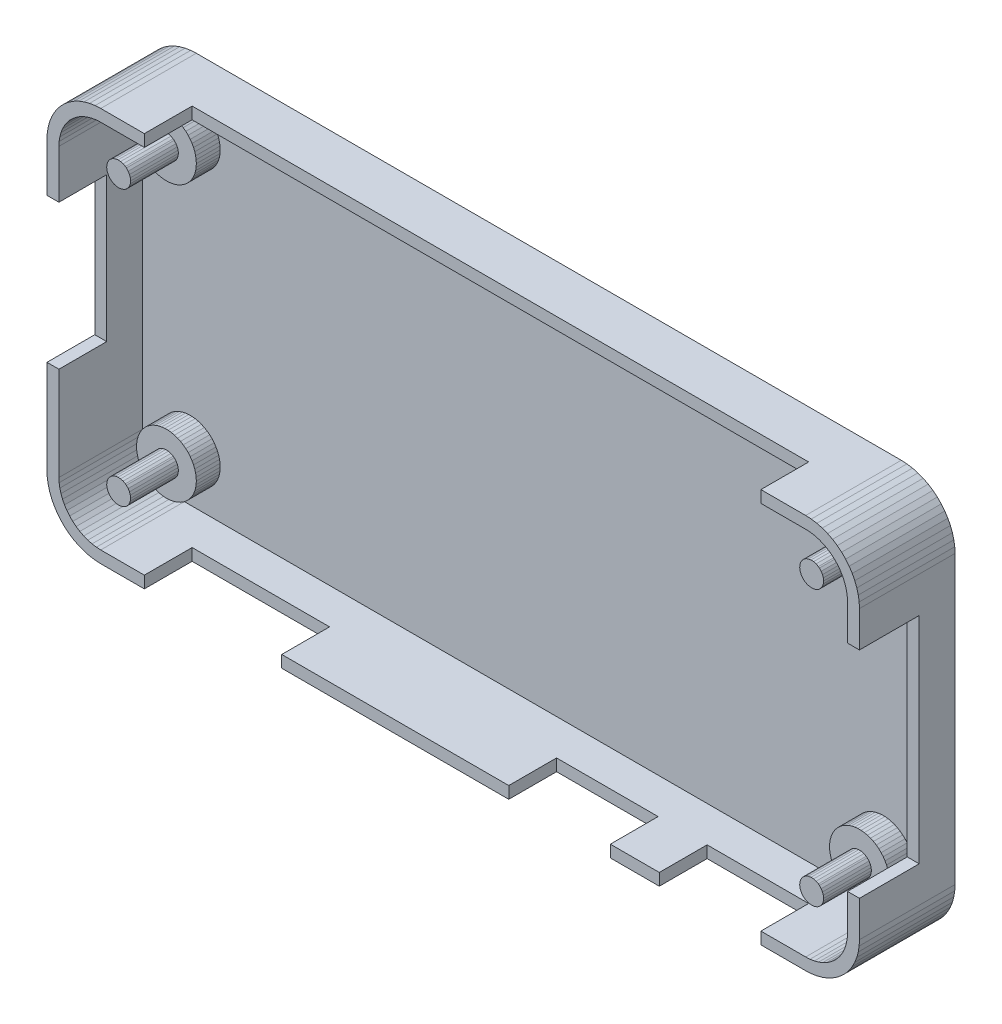
from build123d import *
from OCP.BRepFilletAPI import BRepFilletAPI_MakeChamfer

# Parameters (mm, degrees)
BOSS_EXTRUDE1_DEPTH = 8.00000038
CUT_EXTRUDE1_DEPTH  = 7.000000332
CUT_EXTRUDE2_REACH  = 50.052
SKETCH3_W           = 11.500000022
SKETCH3_H           = 4.00000019
CUT_EXTRUDE3_REACH  = 50.052
SKETCH4_W           = 8.499999996
SKETCH4_H           = 4.00000019
CUT_EXTRUDE4_REACH  = 50.052
SKETCH5_W           = 8.500000462
SKETCH5_H           = 4.00000019
CUT_EXTRUDE5_REACH  = 72.429
SKETCH6_W           = 4.00000019
SKETCH6_H           = 12.1000004
CUT_EXTRUDE6_REACH  = 72.429
SKETCH7_W           = 5.000000354
SKETCH7_H           = 17.999999226
BOSS_EXTRUDE2_DEPTH = 1.999999979
BOSS_EXTRUDE3_DEPTH = 4.00000019
BOSS_EXTRUDE4_DEPTH = 1.999999979
BOSS_EXTRUDE5_DEPTH = 4.00000019
BOSS_EXTRUDE6_DEPTH = 1.999999979
BOSS_EXTRUDE7_DEPTH = 4.00000019
BOSS_EXTRUDE8_DEPTH = 1.999999979
BOSS_EXTRUDE9_DEPTH = 4.00000019
CHAMFER1_SIZE       = 0.054860139
CHAMFER1_SIZE2      = 0.054863094
CHAMFER2_SIZE       = 0.054859988
CHAMFER2_SIZE2      = 0.054863254
CHAMFER3_SIZE       = 0.054856963
CHAMFER3_SIZE2      = 0.05486496
CHAMFER4_SIZE       = 0.054861855
CHAMFER4_SIZE2      = 0.054861534
CHAMFER5_SIZE       = 0.054854337
CHAMFER5_SIZE2      = 0.054868191
CHAMFER6_SIZE       = 0.054859229
CHAMFER6_SIZE2      = 0.054864765
SKETCH16_W          = 51.59999989
SKETCH16_H          = 4.00000019
CUT_EXTRUDE7_DEPTH  = 10


with BuildPart() as part:
    # Sketch1 → Boss-Extrude1 (new body)
    with BuildSketch(Plane(origin=(0, 0, 0), x_dir=(-1, 0, 0), z_dir=(0, 0, -1))):
        Polygon((29.500000179, 16.499999911), (-29.500000179, 16.499999911), (-29.970377684, 16.475347802), (-30.435603112, 16.401663423), (-30.890576541, 16.27975516), (-31.330313534, 16.110954806), (-31.750001013, 15.89711383), (-32.145034522, 15.640577301), (-32.511088997, 15.344151296), (-32.844152302, 15.011087991), (-33.140577376, 14.645033516), (-33.397115767, 14.250000007), (-33.610954881, 13.830315322), (-33.779755235, 13.390576467), (-33.90166536, 12.935603037), (-33.975347877, 12.47037854), (-34.000001848, 12.000000104), (-34.000001848, -12.000000104), (-33.975347877, -12.47037854), (-33.90166536, -12.935603037), (-33.779755235, -13.390576467), (-33.610954881, -13.830315322), (-33.397115767, -14.250000007), (-33.140577376, -14.645033516), (-32.844152302, -15.011087991), (-32.511088997, -15.344151296), (-32.145034522, -15.640577301), (-31.750001013, -15.89711383), (-31.330313534, -16.110954806), (-30.890576541, -16.27975516), (-30.435603112, -16.401663423), (-29.970377684, -16.475347802), (-29.500000179, -16.499999911), (29.500000179, -16.499999911), (29.970377684, -16.475347802), (30.435603112, -16.401663423), (30.890576541, -16.27975516), (31.330313534, -16.110954806), (31.750001013, -15.89711383), (32.145034522, -15.640577301), (32.511088997, -15.344151296), (32.844152302, -15.011087991), (33.140577376, -14.645033516), (33.397115767, -14.250000007), (33.610954881, -13.830315322), (33.779755235, -13.390576467), (33.90166536, -12.935603037), (33.975347877, -12.47037854), (34.000001848, -12.000000104), (34.000001848, 12.000000104), (33.975347877, 12.47037854), (33.90166536, 12.935603037), (33.779755235, 13.390576467), (33.610954881, 13.830315322), (33.397115767, 14.250000007), (33.140577376, 14.645033516), (32.844152302, 15.011087991), (32.511088997, 15.344151296), (32.145034522, 15.640577301), (31.750001013, 15.89711383), (31.330313534, 16.110954806), (30.890576541, 16.27975516), (30.435603112, 16.401663423), (29.970377684, 16.475347802), align=None)
    extrude(amount=-BOSS_EXTRUDE1_DEPTH)

    # Sketch2 → Cut-Extrude1 (cut)
    with BuildSketch(Plane.XY.offset(8.00000038)):
        Polygon((-30.581559986, -15.32869786), (-30.227690935, -15.423515812), (-29.865849763, -15.480826609), (-29.500000179, -15.499999747), (29.500000179, -15.499999747), (29.865849763, -15.480826609), (30.227690935, -15.423515812), (30.581559986, -15.32869786), (30.923578888, -15.197409317), (31.25, -15.031089075), (31.557247043, -14.831559733), (31.841956079, -14.601007104), (32.101005316, -14.341956936), (32.331559807, -14.057248831), (32.531090081, -13.749999925), (32.697409391, -13.423577882), (32.828696072, -13.081559911), (32.923515886, -12.727690861), (32.980825752, -12.365849689), (32.999999821, -12.000000104), (32.999999821, 12.000000104), (32.980825752, 12.365849689), (32.923515886, 12.727690861), (32.828696072, 13.081559911), (32.697409391, 13.423577882), (32.531090081, 13.749999925), (32.331559807, 14.057248831), (32.101005316, 14.341956936), (31.841956079, 14.601007104), (31.557247043, 14.831559733), (31.25, 15.031089075), (30.923578888, 15.197409317), (30.581559986, 15.32869786), (30.227690935, 15.423515812), (29.865849763, 15.480826609), (29.500000179, 15.499999747), (-29.500000179, 15.499999747), (-29.865849763, 15.480826609), (-30.227690935, 15.423515812), (-30.581559986, 15.32869786), (-30.923578888, 15.197409317), (-31.25, 15.031089075), (-31.557247043, 14.831559733), (-31.841956079, 14.601007104), (-32.101005316, 14.341956936), (-32.331559807, 14.057248831), (-32.531090081, 13.749999925), (-32.697409391, 13.423577882), (-32.828696072, 13.081559911), (-32.923515886, 12.727690861), (-32.980825752, 12.365849689), (-32.999999821, 12.000000104), (-32.999999821, -12.000000104), (-32.980825752, -12.365849689), (-32.923515886, -12.727690861), (-32.828696072, -13.081559911), (-32.697409391, -13.423577882), (-32.531090081, -13.749999925), (-32.331559807, -14.057248831), (-32.101005316, -14.341956936), (-31.841956079, -14.601007104), (-31.557247043, -14.831559733), (-31.25, -15.031089075), (-30.923578888, -15.197409317), align=None)
    extrude(amount=-CUT_EXTRUDE1_DEPTH, mode=Mode.SUBTRACT)

    # Sketch3 → Cut-Extrude2 (cut, up to next)
    with BuildSketch(Plane.XZ.offset(16.499999911), mode=Mode.PRIVATE) as cut_extrude2_sk1:
        with Locations((-20.099999849, 6.000000285)):
            Rectangle(SKETCH3_W, SKETCH3_H)
    cut_extrude2_tool1 = extrude(cut_extrude2_sk1.sketch, amount=-CUT_EXTRUDE2_REACH, mode=Mode.PRIVATE) & part.part
    add(cut_extrude2_tool1.solids().sort_by_distance((-20.1, -16.5, 6))[0], mode=Mode.SUBTRACT)

    # Sketch4 → Cut-Extrude3 (cut, up to next)
    with BuildSketch(Plane.XZ.offset(16.499999911), mode=Mode.PRIVATE) as cut_extrude3_sk1:
        with Locations((8.900000015, 6.000000285)):
            Rectangle(SKETCH4_W, SKETCH4_H)
    cut_extrude3_tool1 = extrude(cut_extrude3_sk1.sketch, amount=-CUT_EXTRUDE3_REACH, mode=Mode.PRIVATE) & part.part
    add(cut_extrude3_tool1.solids().sort_by_distance((8.9, -16.5, 6))[0], mode=Mode.SUBTRACT)

    # Sketch5 → Cut-Extrude4 (cut, up to next)
    with BuildSketch(Plane.XZ.offset(16.499999911), mode=Mode.PRIVATE) as cut_extrude4_sk1:
        with Locations((21.499999799, 6.000000285)):
            Rectangle(SKETCH5_W, SKETCH5_H)
    cut_extrude4_tool1 = extrude(cut_extrude4_sk1.sketch, amount=-CUT_EXTRUDE4_REACH, mode=Mode.PRIVATE) & part.part
    add(cut_extrude4_tool1.solids().sort_by_distance((21.5, -16.5, 6))[0], mode=Mode.SUBTRACT)

    # Sketch6 → Cut-Extrude5 (cut, up to next)
    with BuildSketch(Plane.ZY.offset(34.000001848), mode=Mode.PRIVATE) as cut_extrude5_sk1:
        with Locations((6.000000285, 1.900000265)):
            Rectangle(SKETCH6_W, SKETCH6_H)
    cut_extrude5_tool1 = extrude(cut_extrude5_sk1.sketch, amount=-CUT_EXTRUDE5_REACH, mode=Mode.PRIVATE) & part.part
    add(cut_extrude5_tool1.solids().sort_by_distance((-34.000002, 1.9, 6))[0], mode=Mode.SUBTRACT)

    # Sketch7 → Cut-Extrude6 (cut, up to next)
    with BuildSketch(Plane(origin=(34.000001848, 0, 0), x_dir=(0, 0, -1), z_dir=(1, 0, 0)), mode=Mode.PRIVATE) as cut_extrude6_sk1:
        with Locations((-5.500000203, 0)):
            Rectangle(SKETCH7_W, SKETCH7_H)
    cut_extrude6_tool1 = extrude(cut_extrude6_sk1.sketch, amount=-CUT_EXTRUDE6_REACH, mode=Mode.PRIVATE) & part.part
    add(cut_extrude6_tool1.solids().sort_by_distance((34.000002, 0, 5.5))[0], mode=Mode.SUBTRACT)

    # Sketch8 → Boss-Extrude2 (add)
    with BuildSketch(Plane.XY.offset(1.000000047)):
        Polygon((-29.404455796, -9.032933973), (-29.13534455, -9.00366623), (-28.864651918, -9.00366623), (-28.595544398, -9.032933973), (-28.331179172, -9.09112487), (-28.074653819, -9.177558124), (-27.828978375, -9.291219525), (-27.597032487, -9.430777282), (-27.381533757, -9.59459506), (-27.185011655, -9.780751541), (-27.009766549, -9.987064637), (-26.857856661, -10.211115703), (-26.731060818, -10.450277478), (-26.630867273, -10.701745749), (-26.558449492, -10.962573811), (-26.514654979, -11.229702272), (-26.499999687, -11.500000022), (-26.514654979, -11.770297773), (-26.558449492, -12.037426233), (-26.630867273, -12.298253365), (-26.731060818, -12.549722567), (-26.857856661, -12.788884342), (-27.009766549, -13.012935407), (-27.185011655, -13.219248503), (-27.381533757, -13.405404985), (-27.597032487, -13.569222763), (-27.828978375, -13.70878052), (-28.074653819, -13.822441921), (-28.331179172, -13.908875175), (-28.595544398, -13.967066072), (-28.864651918, -13.996333815), (-29.13534455, -13.996333815), (-29.404455796, -13.967066072), (-29.668821022, -13.908875175), (-29.925344512, -13.822441921), (-30.171021819, -13.70878052), (-30.402967706, -13.569222763), (-30.618466437, -13.405404985), (-30.814988539, -13.219248503), (-30.990231782, -13.012935407), (-31.142143533, -12.788884342), (-31.268939376, -12.549722567), (-31.369134784, -12.298253365), (-31.441550702, -12.037426233), (-31.485345215, -11.770297773), (-31.500000507, -11.500000022), (-31.485345215, -11.229702272), (-31.441550702, -10.962573811), (-31.369134784, -10.701745749), (-31.268939376, -10.450277478), (-31.142143533, -10.211115703), (-30.990231782, -9.987064637), (-30.814988539, -9.780751541), (-30.618466437, -9.59459506), (-30.402967706, -9.430777282), (-30.171021819, -9.291219525), (-29.925344512, -9.177558124), (-29.668821022, -9.09112487), align=None)
    extrude(amount=BOSS_EXTRUDE2_DEPTH)

    # Sketch9 → Boss-Extrude3 (add)
    with BuildSketch(Plane.XY.offset(3.000000026)):
        Polygon((-29.907574877, -11.080110446), (-29.796093702, -10.894825682), (-29.647385702, -10.737838224), (-29.468407854, -10.616487823), (-29.267529026, -10.536449961), (-29.054138809, -10.501466691), (-28.838217258, -10.513173416), (-28.629861772, -10.571023449), (-28.390347529, -10.698004365), (-28.203906491, -10.894825682), (-28.092425317, -11.080110446), (-28.023378924, -11.285029352), (-28.000000864, -11.500000022), (-28.023378924, -11.714970693), (-28.092425317, -11.919888668), (-28.203906491, -12.105174363), (-28.352614492, -12.262161821), (-28.438812122, -12.327688746), (-28.531592339, -12.383512221), (-28.732471168, -12.463549152), (-28.945861384, -12.498533353), (-29.161781073, -12.486826628), (-29.370138422, -12.428976595), (-29.561186209, -12.327688746), (-29.725994915, -12.187698856), (-29.856856912, -12.015554123), (-29.947653413, -11.819301173), (-30.005930737, -11.554541704), (-29.97662127, -11.285029352), align=None)
    extrude(amount=BOSS_EXTRUDE3_DEPTH)

    # Sketch10 → Boss-Extrude4 (add)
    with BuildSketch(Plane.XY.offset(1.000000047)):
        Polygon((-26.731060818, 10.450277478), (-26.857856661, 10.211115703), (-27.009766549, 9.987064637), (-27.185011655, 9.780751541), (-27.381533757, 9.59459506), (-27.597032487, 9.430777282), (-27.828978375, 9.291219525), (-28.074653819, 9.177558124), (-28.331179172, 9.09112487), (-28.595544398, 9.032933973), (-28.864651918, 9.00366623), (-29.13534455, 9.00366623), (-29.404455796, 9.032933973), (-29.668821022, 9.09112487), (-29.925344512, 9.177558124), (-30.171021819, 9.291219525), (-30.402967706, 9.430777282), (-30.618466437, 9.59459506), (-30.814988539, 9.780751541), (-30.990231782, 9.987064637), (-31.142143533, 10.211115703), (-31.268939376, 10.450277478), (-31.369134784, 10.701745749), (-31.441550702, 10.962573811), (-31.485345215, 11.229702272), (-31.500000507, 11.500000022), (-31.485345215, 11.770297773), (-31.441550702, 12.037426233), (-31.369134784, 12.298253365), (-31.268939376, 12.549722567), (-31.142143533, 12.788884342), (-30.990231782, 13.012935407), (-30.814988539, 13.219248503), (-30.618466437, 13.405404985), (-30.402967706, 13.569222763), (-30.171021819, 13.70878052), (-29.925344512, 13.822441921), (-29.668821022, 13.908875175), (-29.404455796, 13.967066072), (-29.13534455, 13.996333815), (-28.864651918, 13.996333815), (-28.595544398, 13.967066072), (-28.331179172, 13.908875175), (-28.074653819, 13.822441921), (-27.828978375, 13.70878052), (-27.597032487, 13.569222763), (-27.381533757, 13.405404985), (-27.185011655, 13.219248503), (-27.009766549, 13.012935407), (-26.857856661, 12.788884342), (-26.731060818, 12.549722567), (-26.630867273, 12.298253365), (-26.558449492, 12.037426233), (-26.514654979, 11.770297773), (-26.499999687, 11.500000022), (-26.514654979, 11.229702272), (-26.558449492, 10.962573811), (-26.630867273, 10.701745749), align=None)
    extrude(amount=BOSS_EXTRUDE4_DEPTH)

    # Sketch11 → Boss-Extrude5 (add)
    with BuildSketch(Plane.XY.offset(3.000000026)):
        Polygon((-29.907574877, 11.919888668), (-29.796093702, 12.105174363), (-29.647385702, 12.262161821), (-29.468407854, 12.383512221), (-29.267529026, 12.463549152), (-29.054138809, 12.498533353), (-28.838217258, 12.486826628), (-28.629861772, 12.428976595), (-28.390345307, 12.301993334), (-28.203906491, 12.105174363), (-28.092425317, 11.919888668), (-28.023378924, 11.714970693), (-28.000000864, 11.500000022), (-28.023378924, 11.285029352), (-28.092425317, 11.080110446), (-28.203906491, 10.894825682), (-28.352614492, 10.737838224), (-28.438812122, 10.672310367), (-28.531592339, 10.616487823), (-28.732471168, 10.536449961), (-28.945861384, 10.501466691), (-29.161781073, 10.513173416), (-29.370138422, 10.571023449), (-29.561186209, 10.672310367), (-29.725994915, 10.812300257), (-29.856856912, 10.984445922), (-29.947653413, 11.18069794), (-30.00593072, 11.445458499), (-29.97662127, 11.714970693), align=None)
    extrude(amount=BOSS_EXTRUDE5_DEPTH)

    # Sketch12 → Boss-Extrude6 (add)
    with BuildSketch(Plane.XY.offset(1.000000047)):
        Polygon((30.814988539, -9.780751541), (30.990231782, -9.987064637), (31.142143533, -10.211115703), (31.268939376, -10.450277478), (31.369134784, -10.701745749), (31.441550702, -10.962573811), (31.485345215, -11.229702272), (31.500000507, -11.500000022), (31.485345215, -11.770297773), (31.441550702, -12.037426233), (31.369134784, -12.298253365), (31.268939376, -12.549722567), (31.142143533, -12.788884342), (30.990231782, -13.012935407), (30.814988539, -13.219248503), (30.618466437, -13.405404985), (30.402967706, -13.569222763), (30.171021819, -13.70878052), (29.925344512, -13.822441921), (29.668821022, -13.908875175), (29.404455796, -13.967066072), (29.13534455, -13.996333815), (28.864651918, -13.996333815), (28.595544398, -13.967066072), (28.331179172, -13.908875175), (28.074653819, -13.822441921), (27.828978375, -13.70878052), (27.597032487, -13.569222763), (27.381533757, -13.405404985), (27.185011655, -13.219248503), (27.009766549, -13.012935407), (26.857856661, -12.788884342), (26.731060818, -12.549722567), (26.630867273, -12.298253365), (26.558449492, -12.037426233), (26.514654979, -11.770297773), (26.499999687, -11.500000022), (26.514654979, -11.229702272), (26.558449492, -10.962573811), (26.630867273, -10.701745749), (26.731060818, -10.450277478), (26.857856661, -10.211115703), (27.009766549, -9.987064637), (27.185011655, -9.780751541), (27.381533757, -9.59459506), (27.597032487, -9.430777282), (27.828978375, -9.291219525), (28.074653819, -9.177558124), (28.331179172, -9.09112487), (28.595544398, -9.032933973), (28.864651918, -9.00366623), (29.13534455, -9.00366623), (29.404455796, -9.032933973), (29.668821022, -9.09112487), (29.925344512, -9.177558124), (30.171021819, -9.291219525), (30.402967706, -9.430777282), (30.618466437, -9.59459506), align=None)
    extrude(amount=BOSS_EXTRUDE6_DEPTH)

    # Sketch13 → Boss-Extrude7 (add)
    with BuildSketch(Plane.XY.offset(3.000000026)):
        Polygon((28.092425317, -11.080110446), (28.203906491, -10.894825682), (28.352614492, -10.737838224), (28.531592339, -10.616487823), (28.732471168, -10.536449961), (28.945861384, -10.501466691), (29.161781073, -10.513173416), (29.370138422, -10.571023449), (29.609655021, -10.698006852), (29.796093702, -10.894825682), (29.907574877, -11.080110446), (29.97662127, -11.285029352), (29.999999329, -11.500000022), (29.97662127, -11.714970693), (29.907574877, -11.919888668), (29.796093702, -12.105174363), (29.647385702, -12.262161821), (29.561186209, -12.327688746), (29.468407854, -12.383512221), (29.267529026, -12.463549152), (29.054138809, -12.498533353), (28.838217258, -12.486826628), (28.629861772, -12.428976595), (28.438812122, -12.327688746), (28.274005279, -12.187698856), (28.143143281, -12.015554123), (28.052346781, -11.819301173), (27.994069457, -11.554541704), (28.023378924, -11.285029352), align=None)
    extrude(amount=BOSS_EXTRUDE7_DEPTH)

    # Sketch14 → Boss-Extrude8 (add)
    with BuildSketch(Plane.XY.offset(1.000000047)):
        Polygon((31.369134784, 10.701745749), (31.268939376, 10.450277478), (31.142143533, 10.211115703), (30.990231782, 9.987064637), (30.814988539, 9.780751541), (30.618466437, 9.59459506), (30.402967706, 9.430777282), (30.171021819, 9.291219525), (29.925344512, 9.177558124), (29.668821022, 9.09112487), (29.404455796, 9.032933973), (29.13534455, 9.00366623), (28.864651918, 9.00366623), (28.595544398, 9.032933973), (28.331179172, 9.09112487), (28.074653819, 9.177558124), (27.828978375, 9.291219525), (27.597032487, 9.430777282), (27.381533757, 9.59459506), (27.185011655, 9.780751541), (27.009766549, 9.987064637), (26.857856661, 10.211115703), (26.731060818, 10.450277478), (26.630867273, 10.701745749), (26.558449492, 10.962573811), (26.514654979, 11.229702272), (26.499999687, 11.500000022), (26.514654979, 11.770297773), (26.558449492, 12.037426233), (26.630867273, 12.298253365), (26.731060818, 12.549722567), (26.857856661, 12.788884342), (27.009766549, 13.012935407), (27.185011655, 13.219248503), (27.381533757, 13.405404985), (27.597032487, 13.569222763), (27.828978375, 13.70878052), (28.074653819, 13.822441921), (28.331179172, 13.908875175), (28.595544398, 13.967066072), (28.864651918, 13.996333815), (29.13534455, 13.996333815), (29.404455796, 13.967066072), (29.668821022, 13.908875175), (29.925344512, 13.822441921), (30.171021819, 13.70878052), (30.402967706, 13.569222763), (30.618466437, 13.405404985), (30.814988539, 13.219248503), (30.990231782, 13.012935407), (31.142143533, 12.788884342), (31.268939376, 12.549722567), (31.369134784, 12.298253365), (31.441550702, 12.037426233), (31.485345215, 11.770297773), (31.500000507, 11.500000022), (31.485345215, 11.229702272), (31.441550702, 10.962573811), align=None)
    extrude(amount=BOSS_EXTRUDE8_DEPTH)

    # Sketch15 → Boss-Extrude9 (add)
    with BuildSketch(Plane.XY.offset(3.000000026)):
        Polygon((28.092425317, 11.919888668), (28.203906491, 12.105174363), (28.352614492, 12.262161821), (28.531592339, 12.383512221), (28.732471168, 12.463549152), (28.945861384, 12.498533353), (29.161781073, 12.486826628), (29.370138422, 12.428976595), (29.609657243, 12.301990847), (29.796093702, 12.105174363), (29.907574877, 11.919888668), (29.97662127, 11.714970693), (29.999999329, 11.500000022), (29.97662127, 11.285029352), (29.907574877, 11.080110446), (29.796093702, 10.894825682), (29.647385702, 10.737838224), (29.561186209, 10.672310367), (29.468407854, 10.616487823), (29.267529026, 10.536449961), (29.054138809, 10.501466691), (28.838217258, 10.513173416), (28.629861772, 10.571023449), (28.438812122, 10.672310367), (28.274005279, 10.812300257), (28.143143281, 10.984445922), (28.052346781, 11.18069794), (27.994069474, 11.445458499), (28.023378924, 11.714970693), align=None)
    extrude(amount=BOSS_EXTRUDE9_DEPTH)

    # Chamfer1: one chamfer whose edges measure the first distance from different faces: ONE call of the kernel's chamfer builder (chamfer() names one face for all edges)
    chamfer1_edges_1 = [part.edges().sort_by_distance(p)[0] for p in [
        (27.994069474, 11.445458499, 5.000000121),
    ]]
    chamfer1_side_1 = [part.faces().sort_by_distance(p)[0] for p in [
        (28.023208127, 11.31307822, 5.000000121),
    ]]
    chamfer1_edges_2 = [part.edges().sort_by_distance(p)[0] for p in [
        (-30.00593072, 11.445458499, 5.000000121),
    ]]
    chamfer1_side_2 = [part.faces().sort_by_distance(p)[0] for p in [
        (-29.976792066, 11.31307822, 5.000000121),
    ]]
    chamfer1 = BRepFilletAPI_MakeChamfer(part.part.solid().wrapped)
    for e in chamfer1_edges_1:
        chamfer1.Add(CHAMFER1_SIZE, CHAMFER1_SIZE2, e.wrapped, chamfer1_side_1[0].wrapped)  # the first distance lies on this face
    for e in chamfer1_edges_2:
        chamfer1.Add(CHAMFER1_SIZE, CHAMFER1_SIZE2, e.wrapped, chamfer1_side_2[0].wrapped)  # the first distance lies on this face
    add(Compound.cast(chamfer1.Shape()), mode=Mode.REPLACE)

    # Chamfer2: one chamfer whose edges measure the first distance from different faces: ONE call of the kernel's chamfer builder (chamfer() names one face for all edges)
    chamfer2_edges_1 = [part.edges().sort_by_distance(p)[0] for p in [
        (27.994069457, -11.554541704, 5.000000121),
    ]]
    chamfer2_side_1 = [part.faces().sort_by_distance(p)[0] for p in [
        (28.023208119, -11.686921438, 5.000000121),
    ]]
    chamfer2_edges_2 = [part.edges().sort_by_distance(p)[0] for p in [
        (-30.005930737, -11.554541704, 5.000000121),
    ]]
    chamfer2_side_2 = [part.faces().sort_by_distance(p)[0] for p in [
        (-29.976792075, -11.686921438, 5.000000121),
    ]]
    chamfer2 = BRepFilletAPI_MakeChamfer(part.part.solid().wrapped)
    for e in chamfer2_edges_1:
        chamfer2.Add(CHAMFER2_SIZE, CHAMFER2_SIZE2, e.wrapped, chamfer2_side_1[0].wrapped)  # the first distance lies on this face
    for e in chamfer2_edges_2:
        chamfer2.Add(CHAMFER2_SIZE, CHAMFER2_SIZE2, e.wrapped, chamfer2_side_2[0].wrapped)  # the first distance lies on this face
    add(Compound.cast(chamfer2.Shape()), mode=Mode.REPLACE)

    # Chamfer3
    chamfer3_edges = [part.edges().sort_by_distance(p)[0] for p in [
        (-28.390345307, 12.301993334, 5.000000121),
    ]]
    chamfer3_side = [part.faces().sort_by_distance(p)[0] for p in [
        (-28.510103539, 12.365484965, 5.000000121),
    ]]
    chamfer(chamfer3_edges, length=CHAMFER3_SIZE, length2=CHAMFER3_SIZE2, reference=chamfer3_side[0])

    # Chamfer4
    chamfer4_edges = [part.edges().sort_by_distance(p)[0] for p in [
        (29.609657243, 12.301990847, 5.000000121),
    ]]
    chamfer4_side = [part.faces().sort_by_distance(p)[0] for p in [
        (29.489897832, 12.365483721, 5.000000121),
    ]]
    chamfer(chamfer4_edges, length=CHAMFER4_SIZE, length2=CHAMFER4_SIZE2, reference=chamfer4_side[0])

    # Chamfer5
    chamfer5_edges = [part.edges().sort_by_distance(p)[0] for p in [
        (-28.390347529, -10.698004365, 5.000000121),
    ]]
    chamfer5_side = [part.faces().sort_by_distance(p)[0] for p in [
        (-28.51010465, -10.634513907, 5.000000121),
    ]]
    chamfer(chamfer5_edges, length=CHAMFER5_SIZE, length2=CHAMFER5_SIZE2, reference=chamfer5_side[0])

    # Chamfer6
    chamfer6_edges = [part.edges().sort_by_distance(p)[0] for p in [
        (29.609655021, -10.698006852, 5.000000121),
    ]]
    chamfer6_side = [part.faces().sort_by_distance(p)[0] for p in [
        (29.489896721, -10.634515151, 5.000000121),
    ]]
    chamfer(chamfer6_edges, length=CHAMFER6_SIZE, length2=CHAMFER6_SIZE2, reference=chamfer6_side[0])

    # Sketch16 → Cut-Extrude7 (cut)
    with BuildSketch(Plane(origin=(0, 16.499999911, 0), x_dir=(-1, 0, 0), z_dir=(0, 1, 0))):
        with Locations((0.049999915, 6.000000285)):
            Rectangle(SKETCH16_W, SKETCH16_H)
    extrude(amount=-CUT_EXTRUDE7_DEPTH, mode=Mode.SUBTRACT)


solid = part.part
